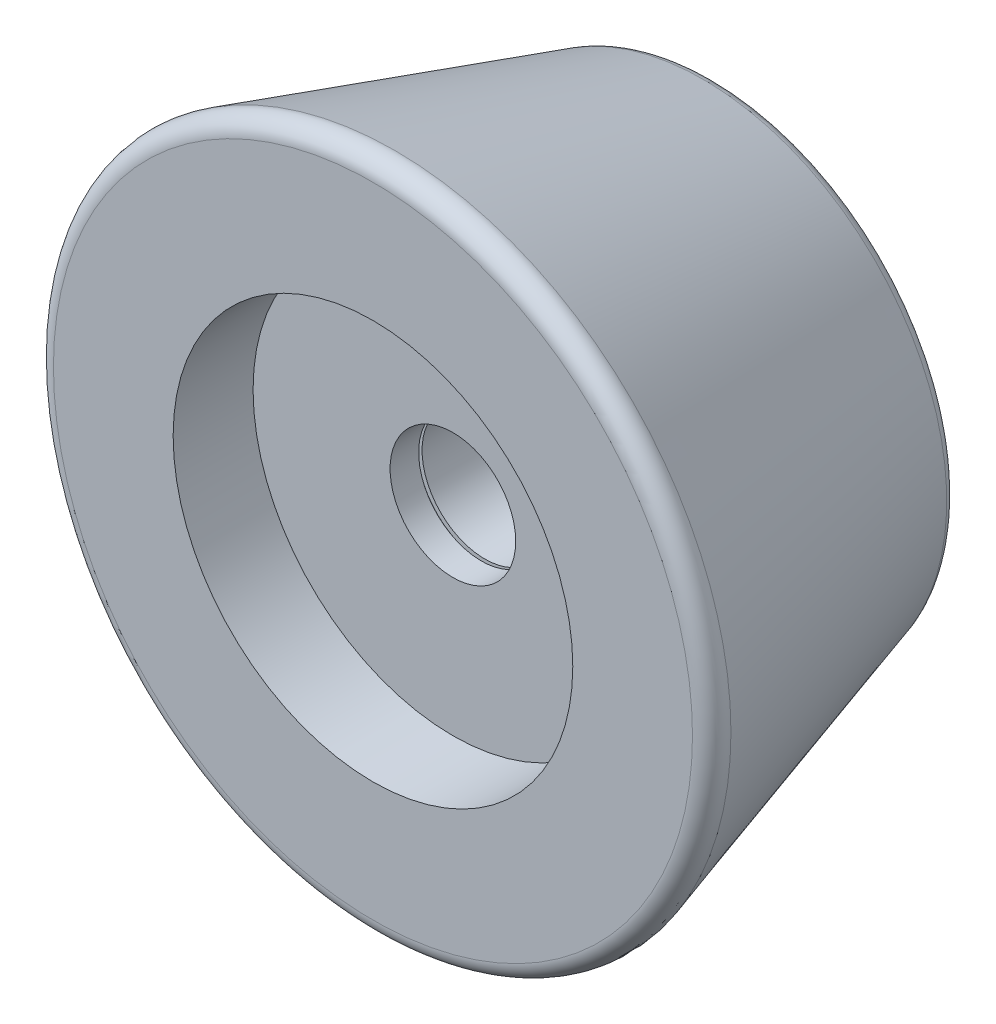
from build123d import *

# Parameters (mm, degrees)
FILLET1_R = 0.75


with BuildPart() as part:
    # Sketch2 → Revolve1 (revolve)
    with BuildSketch(Plane(origin=(0, 0, 0), x_dir=(1, 0, 0), z_dir=(0, 1, 0))):
        Polygon((5.125, 0), (10.5, 0), (15, -15), (8.75, -15), (8.75, -11.5), (2.75, -11.5), (2.75, -10.25), (2.95, -10.25), (2.95, -10.1), (2.75, -10.1), (2.75, -3.25), (5.125, -3.25), align=None)
    revolve(axis=Axis((0, 0, 0), (0, 0, -1)))

    # Fillet1
    fillet1_edges = [part.edges().sort_by_distance(p)[0] for p in [
        (-15, 0, 15),
        (-10.5, 0, 0),
    ]]
    fillet(fillet1_edges, radius=FILLET1_R)


solid = part.part
